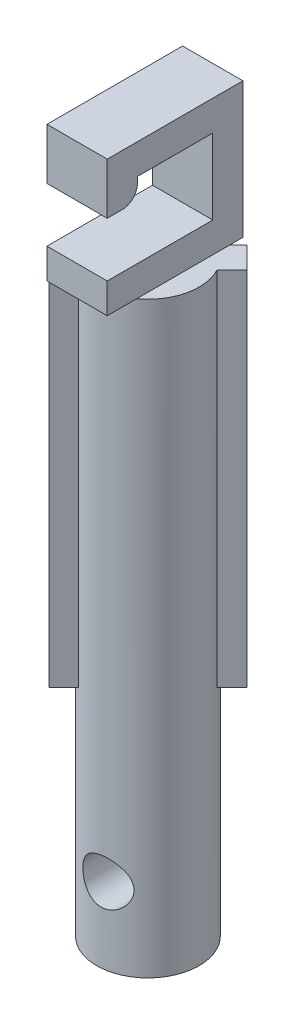
from build123d import *

# Parameters (mm, degrees)
SKETCH1_R             = 1.7
MAIN_SHAFT_DEPTH      = 6
GUIDES_DEPTH          = 12
SKETCH21_W            = 2
SKETCH21_H            = 4.5
HOOK_EXTRUDE_DEPTH    = 4.5
HOOK_CUT_DEPTH        = 12.16947405
HOOK_FILLET_R         = 0.5
SKETCH23_R            = 1.7
TOP_STOPPER_DEPTH     = 2
SKETCH24_R            = 1.7
BOTTOM_SHAFT_DEPTH    = 5.5
F_1_5MM_DOWEL_HOLE2_D = 1.5


with BuildPart() as part:
    # Sketch1 → main shaft (new, symmetric)
    with BuildSketch(Plane(origin=(0, 0, 0), x_dir=(1, 0, 0), z_dir=(0, 1, 0))):
        Circle(SKETCH1_R)
    extrude(amount=MAIN_SHAFT_DEPTH, both=True)

    # Sketch2 → guides (add)
    with BuildSketch(Plane(origin=(0, 6, 0), x_dir=(1, 0, 0), z_dir=(0, 1, 0))):
        with BuildLine():
            Line((-0.795359139, -1.50246592), (-1.290333886, -1.997440667))
            Line((-1.290333886, -1.997440667), (-1.997440667, -1.290333886))
            Line((-1.997440667, -1.290333886), (-1.50246592, -0.795359139))
            ThreePointArc((-1.50246592, -0.795359139), (-1.202081528, -1.202081528), (-0.795359139, -1.50246592))
        make_face()
        with BuildLine():
            Line((1.290333886, 1.997440667), (0.795359139, 1.50246592))
            ThreePointArc((0.795359139, 1.50246592), (1.202081528, 1.202081528), (1.50246592, 0.795359139))
            Line((1.50246592, 0.795359139), (1.997440667, 1.290333886))
            Line((1.997440667, 1.290333886), (1.290333886, 1.997440667))
        make_face()
    extrude(amount=-GUIDES_DEPTH)

    # Sketch21 → hook extrude (add)
    with BuildSketch(Plane(origin=(0, 6, 0), x_dir=(1, 0, 0), z_dir=(0, 1, 0))):
        with Locations((0, -0.1)):
            Rectangle(SKETCH21_W, SKETCH21_H)
    extrude(amount=HOOK_EXTRUDE_DEPTH)

    # Sketch22 → hook cut (cut, through all)
    with BuildSketch(Plane(origin=(1, 0, 0), x_dir=(0, 0, -1), z_dir=(1, 0, 0))):
        Polygon((-2.35, 7), (1.15, 7), (1.15, 9.5), (-1.35, 9.5), (-1.35, 8.8), (-2.35, 8.8), align=None)
    extrude(amount=-HOOK_CUT_DEPTH, mode=Mode.SUBTRACT)

    # hook fillet
    hook_fillet_edges = [part.edges().sort_by_distance(p)[0] for p in [
        (0, 8.8, 1.35),
    ]]
    fillet(hook_fillet_edges, radius=HOOK_FILLET_R)

    # Sketch23 → top stopper (add)
    with BuildSketch(Plane.XZ.offset(6)):
        Circle(SKETCH23_R)
    extrude(amount=TOP_STOPPER_DEPTH)

    # Sketch24 → bottom shaft (add)
    with BuildSketch(Plane.XZ.offset(8)):
        Circle(SKETCH24_R)
    extrude(amount=BOTTOM_SHAFT_DEPTH)

    # Ø1.5mm Dowel Hole2 (through all)
    with Locations(Plane.XY.offset(2.35)):
        with Locations((0.2, -11)):
            Hole(F_1_5MM_DOWEL_HOLE2_D / 2)


solid = part.part
